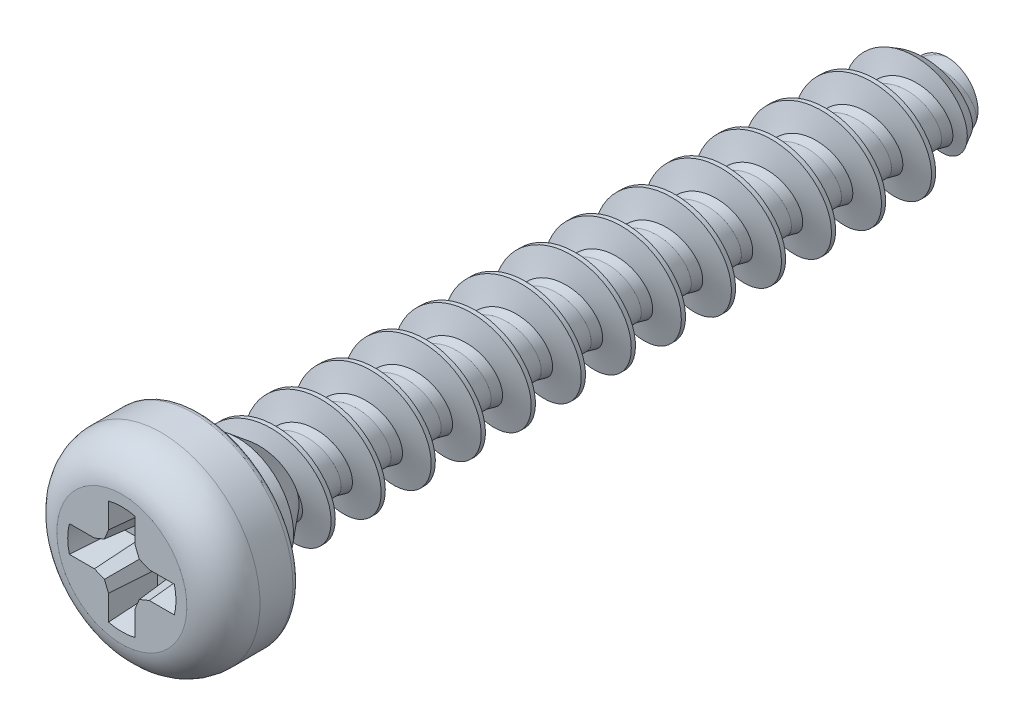
from build123d import *

# Parameters (mm, degrees)
CUT_EXTRUDE1_DEPTH      = 1.2
CIRPATTERN1_COUNT       = 4
DRAFT2_ANGLE            = 5
FILLET1_R               = 0.1675
SWEEP2_PITCH            = 1.34
CUT_EXTRUDE4_DEPTH      = 23.594128051
CUT_EXTRUDE4_DEPTH_BACK = 23.594128051
SKETCH16_W              = 2.1
SKETCH16_H              = 5.3
SKETCH16_W_2            = 3.35
SKETCH14_R              = 1.5
BOSS_EXTRUDE3_DEPTH     = 1


with BuildPart() as part:
    # Sketch3 → Revolve1 (revolve)
    with BuildSketch(Plane(origin=(0, 0, 0), x_dir=(0, 0, -1), z_dir=(1, 0, 0)), mode=Mode.PRIVATE) as revolve1_sk:
        Polygon((0, 0.83), (0, 2.65), (-2.1, 2.65), (-2.1, 0), (20, 0), (20, 0.83), align=None)
    revolve(revolve1_sk.sketch.rotate(Axis((0, 0, 2.1), (0, 0, -1)), 180), axis=Axis((0, 0, 2.1), (0, 0, -1)))

    # Sketch4 → Cut-Revolve1 (revolve, cut)
    with BuildSketch(Plane(origin=(0, 0, 0), x_dir=(0, 0, -1), z_dir=(1, 0, 0)), mode=Mode.PRIVATE) as cut_revolve1_sk:
        with BuildLine():
            Line((-2.1, 1.74), (-2.3, 1.74))
            Line((-2.3, 1.74), (-2.3, 2.85))
            Line((-2.3, 2.85), (0, 2.85))
            Line((0, 2.85), (0, 2.65))
            Line((0, 2.65), (-1.05, 2.65))
            ThreePointArc((-1.05, 2.65), (-1.744730163, 2.390842496), (-2.1, 1.74))
        make_face()
    revolve(cut_revolve1_sk.sketch.rotate(Axis((0, 0, 0), (0, 0, 1)), 180), axis=Axis((0, 0, 0), (0, 0, 1)), mode=Mode.SUBTRACT)

    # Sketch5 → Cut-Extrude1 (cut)
    with BuildSketch(Plane.XY.offset(2.1)):
        with BuildLine():
            Line((0, 1.45), (0, 0))
            Line((0, 0), (1.45, 0))
            ThreePointArc((1.45, 0), (1.444484076, 0.126355668), (1.427978269, 0.25175))
            Line((1.427978269, 0.25175), (0.713989135, 0.25175))
            Line((0.713989135, 0.25175), (0.387136708, 0.387136708))
            Line((0.387136708, 0.387136708), (0.25175, 0.713989135))
            Line((0.25175, 0.713989135), (0.25175, 1.427978269))
            ThreePointArc((0.25175, 1.427978269), (0.126355668, 1.444484076), (0, 1.45))
        make_face()
    cut_extrude1 = extrude(amount=-CUT_EXTRUDE1_DEPTH, mode=Mode.SUBTRACT)

    # CirPattern1: Cut-Extrude1 ×4 about axis
    cirpattern1_axis = Axis((0, 0, 0), (0, 0, 1))
    for i in range(1, CIRPATTERN1_COUNT):
        add(cut_extrude1.rotate(cirpattern1_axis, i * 360 / CIRPATTERN1_COUNT), mode=Mode.SUBTRACT)

    # Draft1: read off the stored shape, not the designer's step
    # Draft1 outline → Draft1 (revolve)
    with BuildSketch(Plane.XZ):
        Polygon((1.45, 2.1), (1.238407623, 0.9), (1.45, 0.9), align=None)
    revolve(axis=Axis((0, 0, 0), (0, 0, 1)))

    # Draft2
    draft2_faces = [part.faces().sort_by_distance(p)[0] for p in [
        (0.25175, 1.020366887, 1.535525523),
        (0.319443354, 0.550562921, 1.5),
        (0.550562921, 0.319443354, 1.5),
        (1.020366887, 0.25175, 1.535525523),
        (1.020366887, -0.25175, 1.535525523),
        (0.550562921, -0.319443354, 1.5),
        (0.319443354, -0.550562921, 1.5),
        (0.25175, -1.020366887, 1.535525523),
        (-0.25175, -1.020366887, 1.535525523),
        (-0.319443354, -0.550562921, 1.5),
        (-0.550562921, -0.319443354, 1.5),
        (-1.020366887, -0.25175, 1.535525523),
        (-1.020366887, 0.25175, 1.535525523),
        (-0.550562921, 0.319443354, 1.5),
        (-0.319443354, 0.550562921, 1.5),
        (-0.25175, 1.020366887, 1.535525523),
    ]]
    draft(draft2_faces, Plane.XY.offset(0.9), DRAFT2_ANGLE)

    # Fillet1
    fillet1_edges = [part.edges().sort_by_distance(p)[0] for p in [
        (0, 2.65, 0),
    ]]
    fillet(fillet1_edges, radius=FILLET1_R)


with BuildPart() as body_2:
    # Split1: the piece on the far side of the plane
    add(part.part)
    split(bisect_by=Plane.XY, keep=Keep.BOTTOM)

    # Sweep2: arcs per turn and ends read off the stored shape
    # Sweep2: the profile of Sketch9 screwed along a right-hand helix through 16.925373 turns, 8 arcs to a turn; built about Z, then put on its axis
    sweep2_z = Axis((0, 0, 0), (0, 0, 1))
    sweep2_corners = [(1.5, 0, -0.414741347), (1.5, 0, -0.526408014), (0.885833333, 0, -0.690973476), (0.83, 0, -0.941149361), (0.629644469, 0, -0.941149361), (0.629644469, 0, 0), (0.83, 0, 0), (0.885833333, 0, -0.250175885)]
    with BuildLine(mode=Mode.PRIVATE) as sweep2_profile:
        Line(sweep2_corners[0], sweep2_corners[1])
        Line(sweep2_corners[1], sweep2_corners[2])
        Line(sweep2_corners[2], sweep2_corners[3])
        Line(sweep2_corners[3], sweep2_corners[4])
        Line(sweep2_corners[4], sweep2_corners[5])
        Line(sweep2_corners[5], sweep2_corners[6])
        Line(sweep2_corners[6], sweep2_corners[7])
        Line(sweep2_corners[7], sweep2_corners[0])
    sweep2_cap = Face(sweep2_profile.wire())
    sweep2_turn_angles = [0, 22.5, 45, 67.5, 90, 112.5, 135, 157.5, 180, 202.5, 225, 247.5, 270, 292.5, 315, 337.5, 360]
    sweep2_turn_weights = [1, 0.9238795325112867, 1, 0.9238795325112867, 1, 0.9238795325112867, 1, 0.9238795325112867, 1, 0.9238795325112867, 1, 0.9238795325112867, 1, 0.9238795325112867, 1, 0.9238795325112867, 1]
    sweep2_turn_rails = [Edge.make_bspline([Vector(p[0], p[1], 0).rotate(sweep2_z, sweep2_turn_angles[k]) / sweep2_turn_weights[k] + Vector(0, 0, p[2] + SWEEP2_PITCH * sweep2_turn_angles[k] / 360) for k in range(17)], [0, 0, 0, 1, 1, 2, 2, 3, 3, 4, 4, 5, 5, 6, 6, 7, 7, 8, 8, 8], 2, sweep2_turn_weights) for p in sweep2_corners]
    sweep2_turn_sides = [Face.make_surface_from_curves(sweep2_turn_rails[p[0]], sweep2_turn_rails[p[1]]) for p in [(0, 1), (1, 2), (2, 3), (3, 4), (4, 5), (5, 6), (6, 7), (7, 0)]]
    sweep2_last_angles = [5760, 5782.5, 5805, 5827.5, 5850, 5872.5, 5895, 5917.5, 5940, 5962.5, 5985, 6007.5, 6030, 6052.5, 6075, 6084.067164179, 6093.134328358]
    sweep2_last_weights = [1, 0.9238795325112867, 1, 0.9238795325112867, 1, 0.9238795325112867, 1, 0.9238795325112867, 1, 0.9238795325112867, 1, 0.9238795325112867, 1, 0.9238795325112867, 1, 0.9875042839058107, 1]
    sweep2_last_rails = [Edge.make_bspline([Vector(p[0], p[1], 0).rotate(sweep2_z, sweep2_last_angles[k]) / sweep2_last_weights[k] + Vector(0, 0, p[2] + SWEEP2_PITCH * sweep2_last_angles[k] / 360) for k in range(17)], [0, 0, 0, 1, 1, 2, 2, 3, 3, 4, 4, 5, 5, 6, 6, 7, 7, 8, 8, 8], 2, sweep2_last_weights) for p in sweep2_corners]
    sweep2_last_sides = [Face.make_surface_from_curves(sweep2_last_rails[p[0]], sweep2_last_rails[p[1]]) for p in [(0, 1), (1, 2), (2, 3), (3, 4), (4, 5), (5, 6), (6, 7), (7, 0)]]
    sweep2 = Plane(origin=(0, 0, -21.34), x_dir=(0, 1, 0), z_dir=(0, 0, 1)) * Solid(Shell([*[p.moved(Location((0, 0, SWEEP2_PITCH * i))) for i in range(16) for p in sweep2_turn_sides], *sweep2_last_sides, sweep2_cap, sweep2_cap.rotate(sweep2_z, 6093.134328358).moved(Location((0, 0, SWEEP2_PITCH * 6093.134328358 / 360)))]))
    add(sweep2)

    # Sketch16 → Cut-Extrude4 (cut, two sides: drawn at the far end of the back side and taken through both)
    with BuildSketch(Plane(origin=(0, 0, 0), x_dir=(0, 0, -1), z_dir=(1, 0, 0)).offset(-CUT_EXTRUDE4_DEPTH_BACK)):
        with Locations((-1.05, 0)):
            Rectangle(SKETCH16_W, SKETCH16_H)
        with Locations((21.675, 0)):
            Rectangle(SKETCH16_W_2, SKETCH16_H)
    extrude(amount=CUT_EXTRUDE4_DEPTH + CUT_EXTRUDE4_DEPTH_BACK, mode=Mode.SUBTRACT)

    # Sketch13 → Cut-Revolve2 (revolve, cut)
    with BuildSketch(Plane(origin=(0, 0, 0), x_dir=(0, 0, -1), z_dir=(1, 0, 0))):
        Polygon((20, 2.65), (20, 0.83), (16.78316089, 2.65), align=None)
    revolve(axis=Axis((0, 0, 0), (0, 0, -1)), mode=Mode.SUBTRACT)


with BuildPart() as part_1:
    add(part.part)

    # Split1
    split(bisect_by=Plane.XY, keep=Keep.TOP)

    add(body_2.part)  # Boss-Extrude3 merges body 2
    # Sketch14 → Boss-Extrude3 (add)
    with BuildSketch(Plane.XY):
        Circle(SKETCH14_R)
    extrude(amount=-BOSS_EXTRUDE3_DEPTH)

    # Boss-Extrude4 cone 1 section (through the dimple's axis) → Boss-Extrude4 (revolve)
    with BuildSketch(Plane(origin=(0, 0, -1), x_dir=(0, -1, 0), z_dir=(1, 0, 0))):
        Polygon((0, 0), (1.5, 0), (0, 1.852345735), align=None)
    revolve(axis=Axis((0, 0, -1), (0, 0, -1)))


solid = part_1.part
